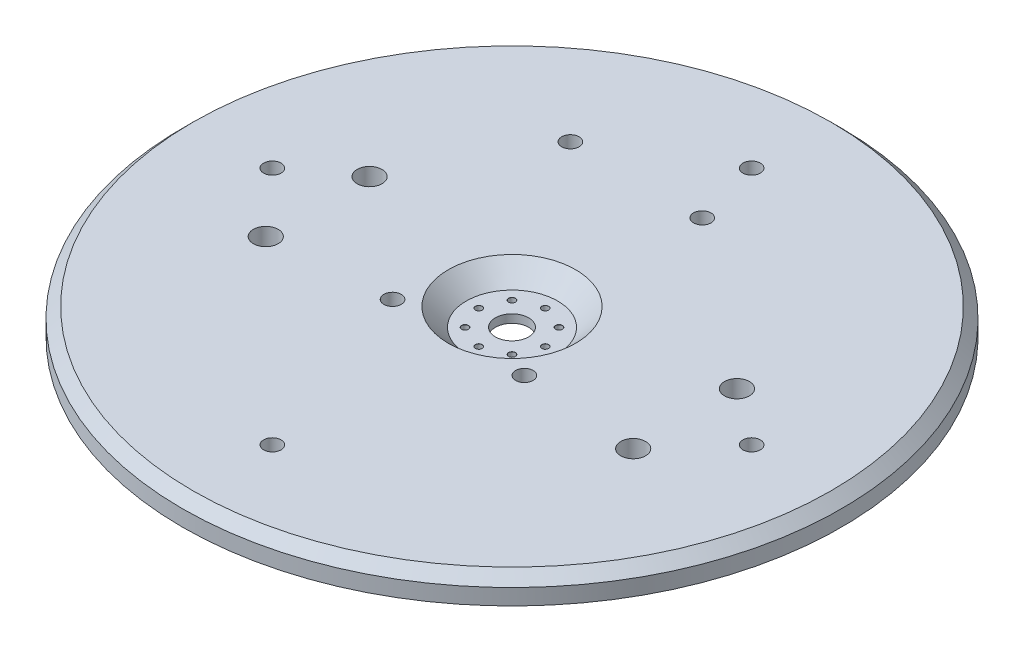
from build123d import *

# Parameters (mm, degrees)
SKETCH1_R                             = 79.375
BOSS_EXTRUDE1_DEPTH                   = 3.175
TAP_DRILL_FOR_M5X0_8_TAP1_D           = 4.2
TAP_DRILL_FOR_M7X1_0_TAP1_D           = 6
SKETCH32_R                            = 4
CUT_EXTRUDE1_DEPTH                    = 113.432663181
SKETCH32_4_R                          = 11
SKETCH32_4_R_2                        = 4
CUT_EXTRUDE2_DEPTH                    = 4.35
CHAMFER1_SIZE                         = 4.35
TAP_DRILL_FOR_M2X0_4_TAP1_D           = 1.6
TAP_DRILL_FOR_M2X0_4_TAP1_CSINK_D     = 1.65
TAP_DRILL_FOR_M2X0_4_TAP1_CSINK_ANGLE = 90
CHAMFER2_SIZE                         = 2.5
TAP_DRILL_FOR_M5X0_8_TAP2_D           = 4.2


with BuildPart() as part:
    # Sketch1 → Boss-Extrude1 (new, symmetric)
    with BuildSketch(Plane(origin=(0, 0, 0), x_dir=(1, 0, 0), z_dir=(0, 1, 0))):
        with Locations(Location((0, 0, 0), (0, 0, 270))):
            Circle(SKETCH1_R)
    extrude(amount=BOSS_EXTRUDE1_DEPTH, both=True)

    # Tap Drill for M5x0.8 Tap1 (through all)
    with Locations(Plane(origin=(0, 3.175, 0), x_dir=(1, 0, 0), z_dir=(0, 1, 0))):
        with Locations((-27.3188086, 41.38978387), (4.4311914, 41.38978387), (-15.875, -12.895910708), (15.875, -12.895910708)):
            Hole(TAP_DRILL_FOR_M5X0_8_TAP1_D / 2)

    # Tap Drill for M7x1.0 Tap1 (through all)
    with Locations(Plane(origin=(0, 3.175, 0), x_dir=(1, 0, 0), z_dir=(0, 1, 0))):
        with Locations((-44.245, 9.941583672), (-44.245, -15.058416328), (44.245, 9.941583672), (44.245, -15.058416328)):
            Hole(TAP_DRILL_FOR_M7X1_0_TAP1_D / 2)

    # Sketch32 → Cut-Extrude1 (cut, through all)
    with BuildSketch(Plane(origin=(0, 3.175, 0), x_dir=(1, 0, 0), z_dir=(0, 1, 0))):
        with Locations(Location((0, 0, 0), (0, 0, 270))):
            Circle(SKETCH32_R)
    extrude(amount=-CUT_EXTRUDE1_DEPTH, mode=Mode.SUBTRACT)

    # Sketch32<4> → Cut-Extrude2 (cut)
    with BuildSketch(Plane(origin=(0, 3.175, 0), x_dir=(1, 0, 0), z_dir=(0, 1, 0))):
        with Locations(Location((0, 0, 0), (0, 0, 270))):
            Circle(SKETCH32_4_R)
        with Locations(Location((0, 0, 0), (0, 0, 270))):
            Circle(SKETCH32_4_R_2, mode=Mode.SUBTRACT)
    extrude(amount=-CUT_EXTRUDE2_DEPTH, mode=Mode.SUBTRACT)

    # Chamfer1
    chamfer1_edges = [part.edges().sort_by_distance(p)[0] for p in [
        (0, 3.175, -11),
    ]]
    chamfer(chamfer1_edges, length=CHAMFER1_SIZE - 0.0001)  # a hair under: the kernel refuses the full size

    # Tap Drill for M2x0.4 Tap1 (through all)
    with Locations(Plane(origin=(0, -1.175, 0), x_dir=(1, 0, 0), z_dir=(0, 1, 0))):
        with Locations((-8, 0), (-5.656854249, 5.656854249), (0, 8), (5.656854249, 5.656854249), (8, 0), (5.656854249, -5.656854249), (0, -8), (-5.656854249, -5.656854249)):
            CounterSinkHole(TAP_DRILL_FOR_M2X0_4_TAP1_D / 2, TAP_DRILL_FOR_M2X0_4_TAP1_CSINK_D / 2, counter_sink_angle=TAP_DRILL_FOR_M2X0_4_TAP1_CSINK_ANGLE)

    # Chamfer2
    chamfer2_edges = [part.edges().sort_by_distance(p)[0] for p in [
        (0, 3.175, -79.375),
    ]]
    chamfer(chamfer2_edges, length=CHAMFER2_SIZE)

    # Tap Drill for M5x0.8 Tap2 (through all)
    with Locations(Plane(origin=(0, 3.175, 0), x_dir=(1, 0, 0), z_dir=(0, 1, 0))):
        with Locations((-57.723385101, 0), (0, 57.723385101), (57.723385101, 0), (0, -57.723385101)):
            Hole(TAP_DRILL_FOR_M5X0_8_TAP2_D / 2)


solid = part.part
